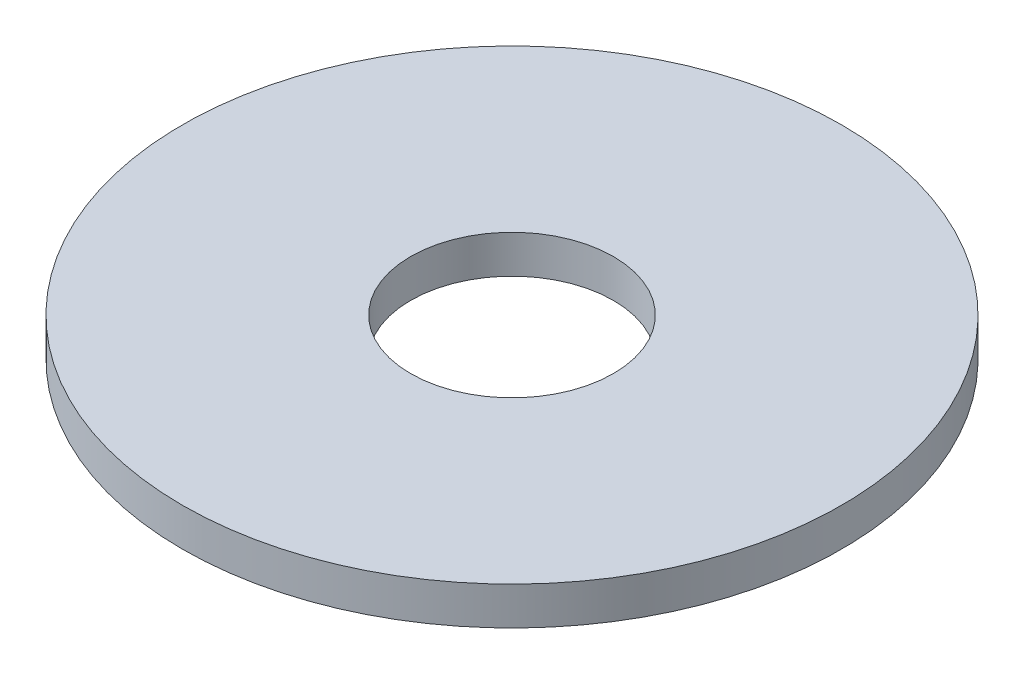
from build123d import *

# Parameters (mm, degrees)
SKETCH1_R           = 13
SKETCH1_R_2         = 4
BOSS_EXTRUDE1_DEPTH = 1.5


with BuildPart() as part:
    # Sketch1 → Boss-Extrude1 (new body)
    with BuildSketch(Plane(origin=(0, 0, 0), x_dir=(1, 0, 0), z_dir=(0, 1, 0))):
        Circle(SKETCH1_R)
        Circle(SKETCH1_R_2, mode=Mode.SUBTRACT)
    extrude(amount=BOSS_EXTRUDE1_DEPTH)


solid = part.part
